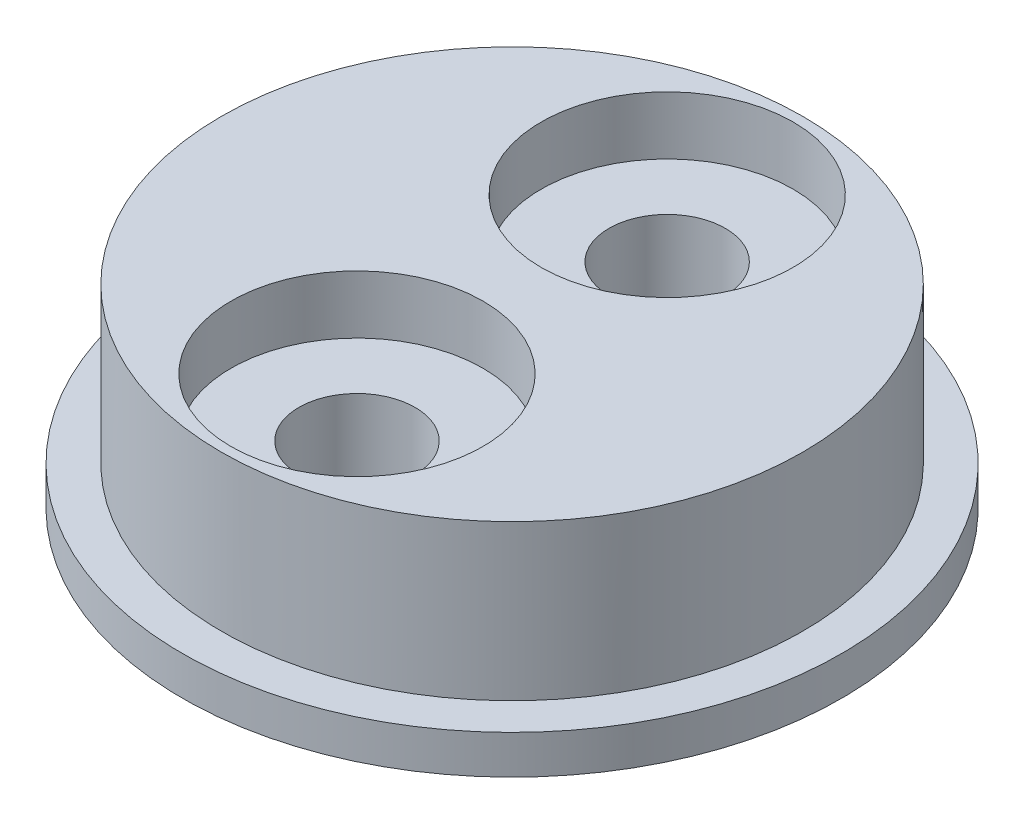
from build123d import *

# Parameters (mm, degrees)
SKETCH1_R           = 7.5
BOSS_EXTRUDE1_DEPTH = 5
SKETCH2_R           = 3.25
CUT_EXTRUDE1_DEPTH  = 1.5
SKETCH4_R           = 8.5
BOSS_EXTRUDE2_DEPTH = 1
SKETCH3_R           = 1.5
CUT_EXTRUDE2_DEPTH  = 14.019216566


with BuildPart() as part:
    # Sketch1 → Boss-Extrude1 (new body)
    with BuildSketch(Plane(origin=(0, 0, 0), x_dir=(1, 0, 0), z_dir=(0, 1, 0))):
        Circle(SKETCH1_R)
    extrude(amount=BOSS_EXTRUDE1_DEPTH)

    # Sketch2 → Cut-Extrude1 (cut)
    with BuildSketch(Plane(origin=(0, 5, 0), x_dir=(1, 0, 0), z_dir=(0, 1, 0))):
        with Locations((0, 4)):
            Circle(SKETCH2_R)
        with Locations((0, -4)):
            Circle(SKETCH2_R)
    extrude(amount=-CUT_EXTRUDE1_DEPTH, mode=Mode.SUBTRACT)

    # Sketch4 → Boss-Extrude2 (add)
    with BuildSketch(Plane.XZ):
        Circle(SKETCH4_R)
    extrude(amount=-BOSS_EXTRUDE2_DEPTH)

    # Sketch3 → Cut-Extrude2 (cut, through all)
    with BuildSketch(Plane(origin=(0, 5, 0), x_dir=(1, 0, 0), z_dir=(0, 1, 0))):
        with Locations((0, 4)):
            Circle(SKETCH3_R)
        with Locations((0, -4)):
            Circle(SKETCH3_R)
    extrude(amount=-CUT_EXTRUDE2_DEPTH, mode=Mode.SUBTRACT)


solid = part.part
